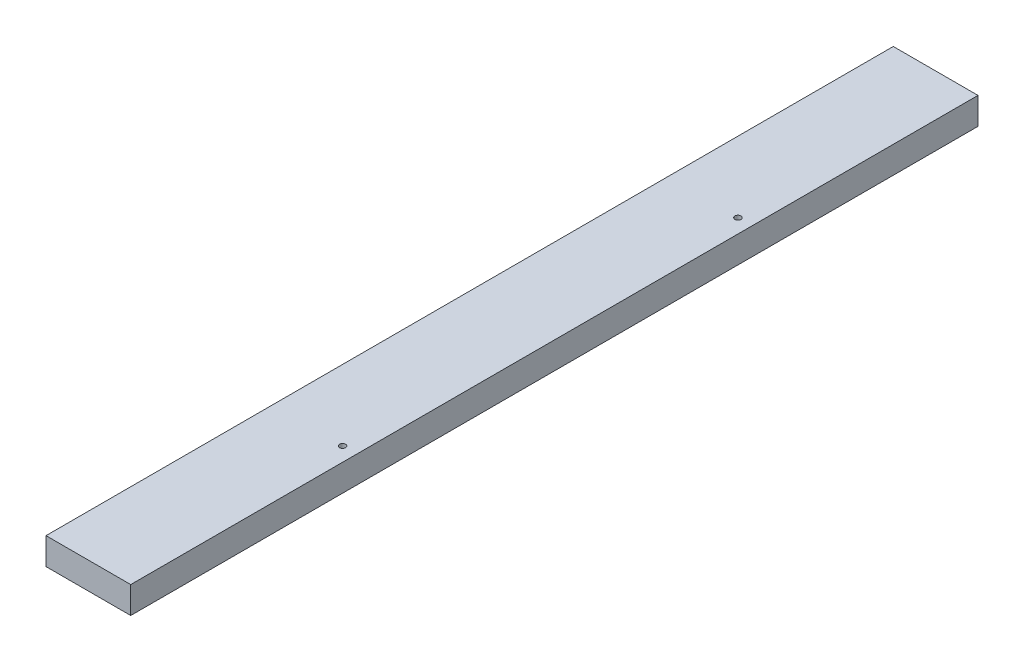
from build123d import *

# Parameters (mm, degrees)
SKETCH1_W                                       = 60
SKETCH1_H                                       = 19
BOSS_EXTRUDE1_DEPTH                             = 600
SKETCH2_R                                       = 2.5
CUT_EXTRUDE1_DEPTH                              = 10
CSK_FOR_M4_FLAT_HEAD_MACHINE_SCREW1_D           = 4.3
CSK_FOR_M4_FLAT_HEAD_MACHINE_SCREW1_CSINK_D     = 9.4
CSK_FOR_M4_FLAT_HEAD_MACHINE_SCREW1_CSINK_ANGLE = 90


with BuildPart() as part:
    # Sketch1 → Boss-Extrude1 (new body)
    with BuildSketch(Plane.XY):
        with Locations((30, 9.5)):
            Rectangle(SKETCH1_W, SKETCH1_H)
    extrude(amount=BOSS_EXTRUDE1_DEPTH)

    # Sketch2 → Cut-Extrude1 (cut)
    with BuildSketch(Plane(origin=(0, 0, 0), x_dir=(-1, 0, 0), z_dir=(0, -1, 0))):
        with Locations((-38, -8)):
            Circle(SKETCH2_R)
        with Locations((-38, -592)):
            Circle(SKETCH2_R)
    extrude(amount=-CUT_EXTRUDE1_DEPTH, mode=Mode.SUBTRACT)

    # CSK for M4 Flat Head Machine Screw1 (through all)
    with Locations(Plane(origin=(0, 0, 0), x_dir=(-1, 0, 0), z_dir=(0, -1, 0))):
        with Locations((-50, -160), (-50, -440)):
            CounterSinkHole(CSK_FOR_M4_FLAT_HEAD_MACHINE_SCREW1_D / 2, CSK_FOR_M4_FLAT_HEAD_MACHINE_SCREW1_CSINK_D / 2, counter_sink_angle=CSK_FOR_M4_FLAT_HEAD_MACHINE_SCREW1_CSINK_ANGLE)


solid = part.part
